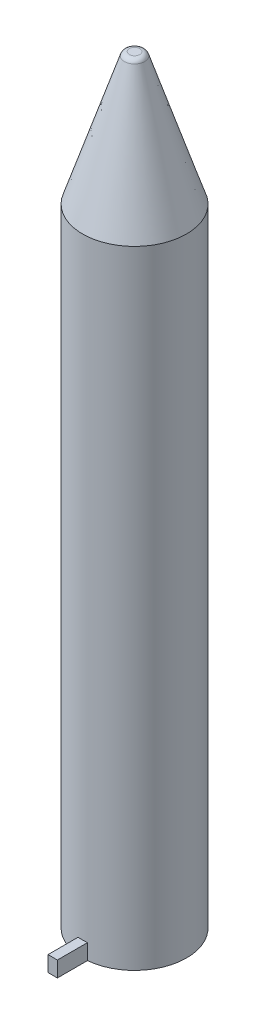
from build123d import *

# Parameters (mm, degrees)
SKETCH1_R           = 10
BOSS_EXTRUDE1_DEPTH = 120.65
BOSS_EXTRUDE2_DEPTH = 3
SKETCH4_R           = 6.25
CUT_EXTRUDE1_DEPTH  = 4


with BuildPart() as part:
    # Sketch1 → Boss-Extrude1 (new body)
    with BuildSketch(Plane(origin=(0, 0, 0), x_dir=(1, 0, 0), z_dir=(0, 1, 0))):
        Circle(SKETCH1_R)
    extrude(amount=BOSS_EXTRUDE1_DEPTH)

    # Sketch2 → Revolve1 (revolve)
    with BuildSketch(Plane.XY):
        with BuildLine():
            Line((0, 120.65), (0, 146.05))
            Line((0, 146.05), (1, 146.05))
            ThreePointArc((1, 146.05), (1.587481775, 145.859237397), (1.950824444, 145.359730328))
            Line((1.950824444, 145.359730328), (10, 120.65))
            Line((10, 120.65), (0, 120.65))
        make_face()
    revolve(axis=Axis((0, 120.65, 0), (0, 1, 0)))

    # Sketch3 → Boss-Extrude2 (add)
    with BuildSketch(Plane.XZ):
        with BuildLine():
            Line((-0.9, 15.75), (0.9, 15.75))
            Line((0.9, 15.75), (0.9, 9.354806465))
            ThreePointArc((0.9, 9.354806465), (0, 9.398), (-0.9, 9.354806465))
            Line((-0.9, 9.354806465), (-0.9, 15.75))
        make_face()
    extrude(amount=-BOSS_EXTRUDE2_DEPTH)

    # Sketch4 → Cut-Extrude1 (cut)
    with BuildSketch(Plane.XZ):
        Circle(SKETCH4_R)
    extrude(amount=-CUT_EXTRUDE1_DEPTH, mode=Mode.SUBTRACT)


solid = part.part
